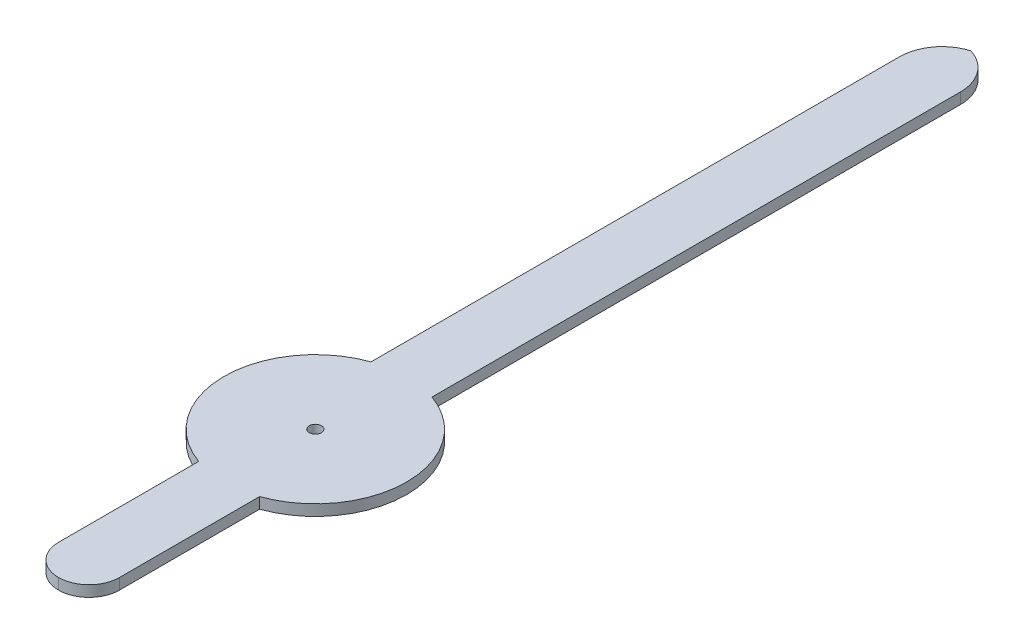
from build123d import *

# Parameters (mm, degrees)
SKETCH1_R           = 0.1
BOSS_EXTRUDE1_DEPTH = 0.18
FILLET1_R           = 0.5
FILLET2_R           = 0.7


# Some blends are built 0.0001 mm under size
with BuildPart() as part:
    # Sketch1 → Boss-Extrude1 (new body)
    with BuildSketch(Plane(origin=(0, 0, 0), x_dir=(1, 0, 0), z_dir=(0, 1, 0))):
        with BuildLine():
            Line((-0.5, -4.214213562), (-0.5, -1.414213562))
            ThreePointArc((-0.5, -1.414213562), (-1.5, 0), (-0.5, 1.414213562))
            Line((-0.5, 1.414213562), (-0.5, 10.785786438))
            Line((-0.5, 10.785786438), (0.5, 10.785786438))
            Line((0.5, 10.785786438), (0.5, 1.414213562))
            ThreePointArc((0.5, 1.414213562), (1.5, 0), (0.5, -1.414213562))
            Line((0.5, -1.414213562), (0.5, -4.214213562))
            Line((0.5, -4.214213562), (-0.5, -4.214213562))
        make_face()
        with Locations(Location((0, 0, 0), (0, 0, 270))):
            Circle(SKETCH1_R, mode=Mode.SUBTRACT)
    extrude(amount=BOSS_EXTRUDE1_DEPTH)

    # Fillet1
    fillet1_edges = [part.edges().sort_by_distance(p)[0] for p in [
        (-0.5, 0.09, 4.214213562),
        (0.5, 0.09, 4.214213562),
    ]]
    fillet(fillet1_edges, radius=FILLET1_R - 0.0001)  # a hair under: the kernel refuses the full size

    # Fillet2
    # the kernel refuses this fillet: 0.7 mm, written as the material it takes off along each edge
    with BuildSketch(Plane(origin=(-0.5, -1.75, -10.785786438), x_dir=(1, 0, 0), z_dir=(0, 1, 0)), Plane(origin=(0.5, -1.75, -10.785786438), x_dir=(0, 0, 1), z_dir=(0, 1, 0))) as fillet2_piece_1:
        with BuildLine():
            CenterArc((FILLET2_R, -FILLET2_R), FILLET2_R, 90, 90)
            Line((0, -FILLET2_R), (0, 0))
            Line((0, 0), (FILLET2_R, 0))
        make_face()
    extrude(amount=3.68, mode=Mode.SUBTRACT)


solid = part.part
